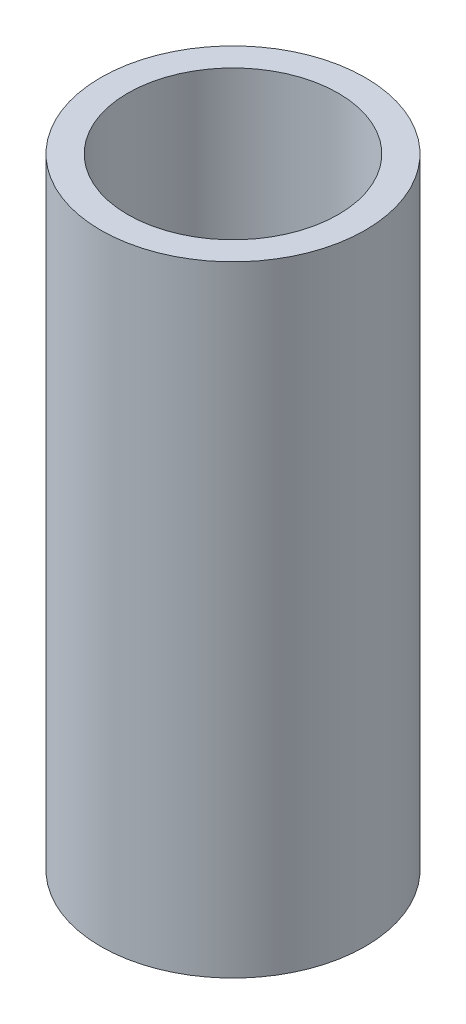
from build123d import *

# Parameters (mm, degrees)
SKETCH1_R           = 20
BOSS_EXTRUDE1_DEPTH = 93.815798569
SKETCH2_R           = 15.918213354
CUT_EXTRUDE1_DEPTH  = 98.986754518


with BuildPart() as part:
    # Sketch1 → Boss-Extrude1 (new body)
    with BuildSketch(Plane(origin=(0, 0, 0), x_dir=(1, 0, 0), z_dir=(0, 1, 0))):
        Circle(SKETCH1_R)
    extrude(amount=BOSS_EXTRUDE1_DEPTH)

    # Sketch2 → Cut-Extrude1 (cut, through all)
    with BuildSketch(Plane(origin=(0, 0, 0), x_dir=(1, 0, 0), z_dir=(0, 1, 0))):
        Circle(SKETCH2_R)
    extrude(amount=CUT_EXTRUDE1_DEPTH, mode=Mode.SUBTRACT)


solid = part.part
